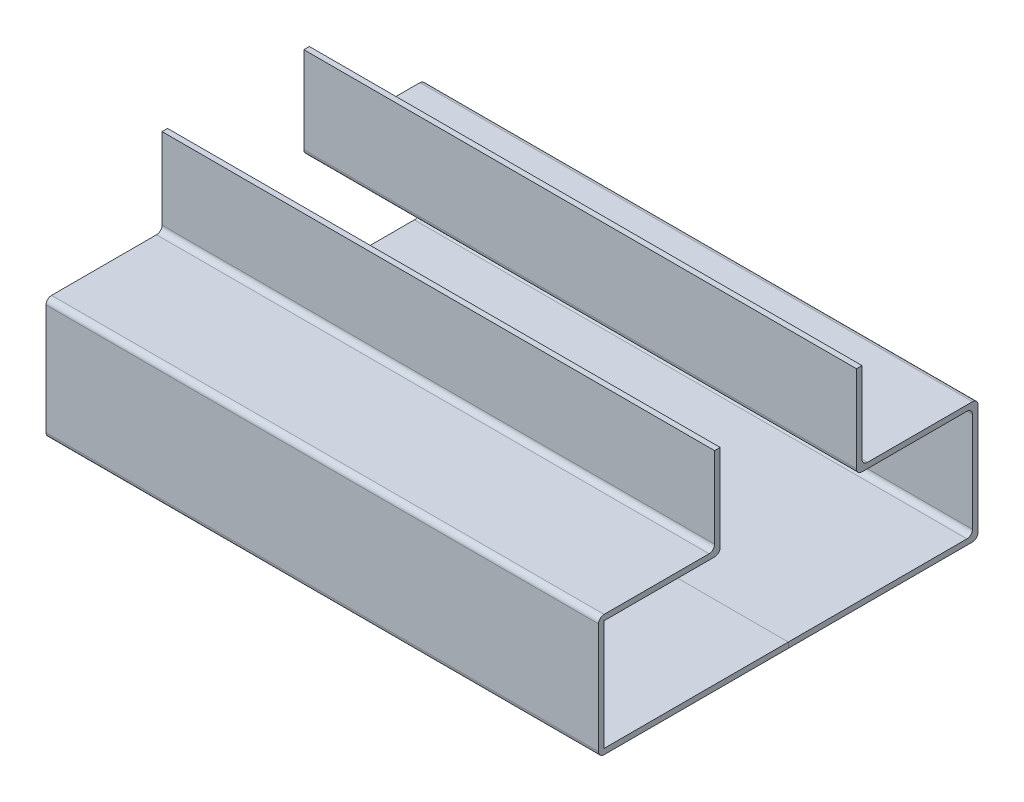
from build123d import *

# Parameters (mm, degrees)
EXTRUDE_1_DEPTH      = 75
EXTRUDE_1_DEPTH_BACK = 75
FILLET_2_R           = 1.5
FILLET_3_R           = 1.5
FILLET_7_R           = 1.5


with BuildPart() as part:
    # 草圖1 → 擠出1 (new, two sides: drawn at the far end of the back side and taken through both)
    with BuildSketch(Plane.YZ.offset(-EXTRUDE_1_DEPTH_BACK)):
        with BuildLine():
            Line((30, 51.5), (0, 51.5))
            ThreePointArc((0, 51.5), (-1.060660172, 51.060660172), (-1.5, 50))
            Line((-1.5, 50), (-1.5, 0))
            Line((-1.5, 0), (0, 0))
            Line((0, 0), (0, 50))
            Line((0, 50), (30, 50))
            Line((30, 50), (30, 18.5))
            Line((30, 18.5), (55, 18.5))
            Line((55, 18.5), (55, 20))
            Line((55, 20), (33, 20))
            ThreePointArc((33, 20), (31.939339828, 20.439339828), (31.5, 21.5))
            Line((31.5, 21.5), (31.5, 50))
            ThreePointArc((31.5, 50), (31.060660172, 51.060660172), (30, 51.5))
        make_face()
    extrude(amount=EXTRUDE_1_DEPTH + EXTRUDE_1_DEPTH_BACK)


with BuildPart() as body_2:
    # 鏡射1: mirrored copy
    add(part.part.mirror(Plane(origin=(15, -0.75, 0), x_dir=(1, 0, 0), z_dir=(0, 0, -1))))

    # 圓角3
    fillet_3_edges = [body_2.edges().sort_by_distance(p)[0] for p in [
        (0, 30, -18.5),
    ]]
    fillet(fillet_3_edges, radius=FILLET_3_R)

    # 圓角7
    fillet_7_edges = [body_2.edges().sort_by_distance(p)[0] for p in [
        (0, 0, -50),
        (0, 30, -50),
    ]]
    fillet(fillet_7_edges, radius=FILLET_7_R)


with BuildPart() as part_1:
    add(part.part)

    # 圓角2
    fillet_2_edges = [part_1.edges().sort_by_distance(p)[0] for p in [
        (0, 30, 18.5),
    ]]
    fillet(fillet_2_edges, radius=FILLET_2_R)


solid = Compound([body_2.part, part_1.part])
